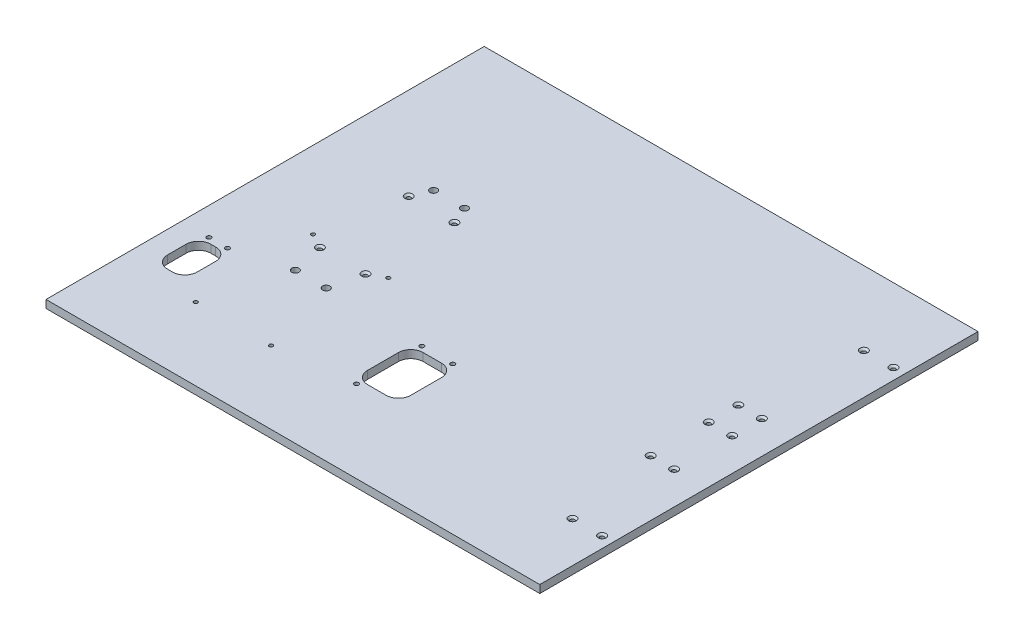
from build123d import *

# Parameters (mm, degrees)
SKETCH1_W                                       = 355
SKETCH1_H                                       = 6.35
BOSS_EXTRUDE1_DEPTH                             = 200
SKETCH9_R                                       = 1.5
CUT_EXTRUDE8_DEPTH                              = 10
SKETCH19_R                                      = 1.5
CUT_EXTRUDE9_DEPTH                              = 10
CSK_FOR_M3_FLAT_HEAD_MACHINE_SCREW3_D           = 3.4
CSK_FOR_M3_FLAT_HEAD_MACHINE_SCREW3_DEPTH       = 10
CSK_FOR_M3_FLAT_HEAD_MACHINE_SCREW3_CSINK_D     = 6.3
CSK_FOR_M3_FLAT_HEAD_MACHINE_SCREW3_CSINK_ANGLE = 90
CSK_FOR_M3_FLAT_HEAD_MACHINE_SCREW3_TIP         = 1.021463052
SKETCH28_R                                      = 1.75
CUT_EXTRUDE11_DEPTH                             = 10
M5_CLEARANCE_HOLE1_D                            = 5.8


with BuildPart() as part:
    # Sketch1 → Boss-Extrude1 (new, symmetric)
    with BuildSketch(Plane(origin=(0, 0, 0), x_dir=(0, 0, -1), z_dir=(1, 0, 0))):
        with Locations((0, -3.175)):
            Rectangle(SKETCH1_W, SKETCH1_H)
    extrude(amount=BOSS_EXTRUDE1_DEPTH, both=True)

    # Sketch9 → Cut-Extrude8 (cut)
    with BuildSketch(Plane(origin=(0, 0, 0), x_dir=(1, 0, 0), z_dir=(0, 1, 0))):
        with Locations((-125.5, 41.85)):
            Circle(SKETCH9_R)
        with Locations((-88.5, 41.85)):
            Circle(SKETCH9_R)
        with Locations((-125.5, -30.15)):
            Circle(SKETCH9_R)
        with Locations((-88.5, -30.15)):
            Circle(SKETCH9_R)
        with Locations((154.5, 28.85)):
            Circle(SKETCH9_R)
        with Locations((173.5, 4.85)):
            Circle(SKETCH9_R)
        with Locations((154.5, 4.85)):
            Circle(SKETCH9_R)
        with Locations((173.5, 28.85)):
            Circle(SKETCH9_R)
        with Locations((154.5, -42.15)):
            Circle(SKETCH9_R)
        with Locations((173.5, -42.15)):
            Circle(SKETCH9_R)
    extrude(amount=-CUT_EXTRUDE8_DEPTH, mode=Mode.SUBTRACT)

    # Sketch19 → Cut-Extrude9 (cut)
    with BuildSketch(Plane(origin=(0, 0, 0), x_dir=(1, 0, 0), z_dir=(0, 1, 0))):
        with Locations((-137.5, -23.7)):
            Circle(SKETCH19_R)
        with Locations((-76.5, -23.7)):
            Circle(SKETCH19_R)
        with Locations((-76.5, -118.7)):
            Circle(SKETCH19_R)
        with Locations((-137.5, -118.7)):
            Circle(SKETCH19_R)
    extrude(amount=-CUT_EXTRUDE9_DEPTH, mode=Mode.SUBTRACT)

    # CSK for M3 Flat Head Machine Screw3
    with Locations(Plane(origin=(0, 0, 0), x_dir=(-1, 0, 0), z_dir=(0, 1, 0))):
        with Locations((88.5, -41.85), (125.5, -41.85), (125.5, 30.15), (88.5, 30.15), (-167, 118), (-191, 118), (-154.5, 42.15), (-173.5, 42.15), (-173.5, -4.85), (-154.5, -4.85), (-173.5, -28.85), (-154.5, -28.85), (-191, -118), (-167, -118)):
            CounterSinkHole(CSK_FOR_M3_FLAT_HEAD_MACHINE_SCREW3_D / 2, CSK_FOR_M3_FLAT_HEAD_MACHINE_SCREW3_CSINK_D / 2, depth=CSK_FOR_M3_FLAT_HEAD_MACHINE_SCREW3_DEPTH, counter_sink_angle=CSK_FOR_M3_FLAT_HEAD_MACHINE_SCREW3_CSINK_ANGLE)
            with Locations((0, 0, -(CSK_FOR_M3_FLAT_HEAD_MACHINE_SCREW3_DEPTH + CSK_FOR_M3_FLAT_HEAD_MACHINE_SCREW3_TIP / 2))):  # 118° drill point
                Cone(0, CSK_FOR_M3_FLAT_HEAD_MACHINE_SCREW3_D / 2, CSK_FOR_M3_FLAT_HEAD_MACHINE_SCREW3_TIP, mode=Mode.SUBTRACT)

    # Sketch28 → Cut-Extrude11 (cut)
    with BuildSketch(Plane(origin=(0, 0, 0), x_dir=(-1, 0, 0), z_dir=(0, 1, 0))):
        with Locations((15, 111)):
            Circle(SKETCH28_R)
        with Locations((15, 58)):
            Circle(SKETCH28_R)
        with Locations((-10, 58)):
            Circle(SKETCH28_R)
        with Locations((162.5, 68)):
            Circle(SKETCH28_R)
        with Locations((177.5, 68)):
            Circle(SKETCH28_R)
        with BuildLine():
            Line((10, 62), (-5, 62))
            ThreePointArc((-5, 62), (-12.071067812, 64.928932188), (-15, 72))
            Line((-15, 72), (-15, 97))
            ThreePointArc((-15, 97), (-12.071067812, 104.071067812), (-5, 107))
            Line((-5, 107), (10, 107))
            ThreePointArc((10, 107), (17.071067812, 104.071067812), (20, 97))
            Line((20, 97), (20, 72))
            ThreePointArc((20, 72), (17.071067812, 64.928932188), (10, 62))
        make_face()
        with BuildLine():
            Line((168, 107), (172, 107))
            ThreePointArc((172, 107), (179.071067812, 104.071067812), (182, 97))
            Line((182, 97), (182, 82))
            ThreePointArc((182, 82), (179.071067812, 74.928932188), (172, 72))
            Line((172, 72), (168, 72))
            ThreePointArc((168, 72), (160.928932188, 74.928932188), (158, 82))
            Line((158, 82), (158, 97))
            ThreePointArc((158, 97), (160.928932188, 104.071067812), (168, 107))
        make_face()
    extrude(amount=-CUT_EXTRUDE11_DEPTH, mode=Mode.SUBTRACT)

    # M5 Clearance Hole1 (through all)
    with Locations(Plane(origin=(0, 0, 0), x_dir=(1, 0, 0), z_dir=(0, 1, 0))):
        with Locations((-119.5, 56), (-94.5, 56), (-94.5, -56), (-119.5, -56)):
            Hole(M5_CLEARANCE_HOLE1_D / 2)


solid = part.part
